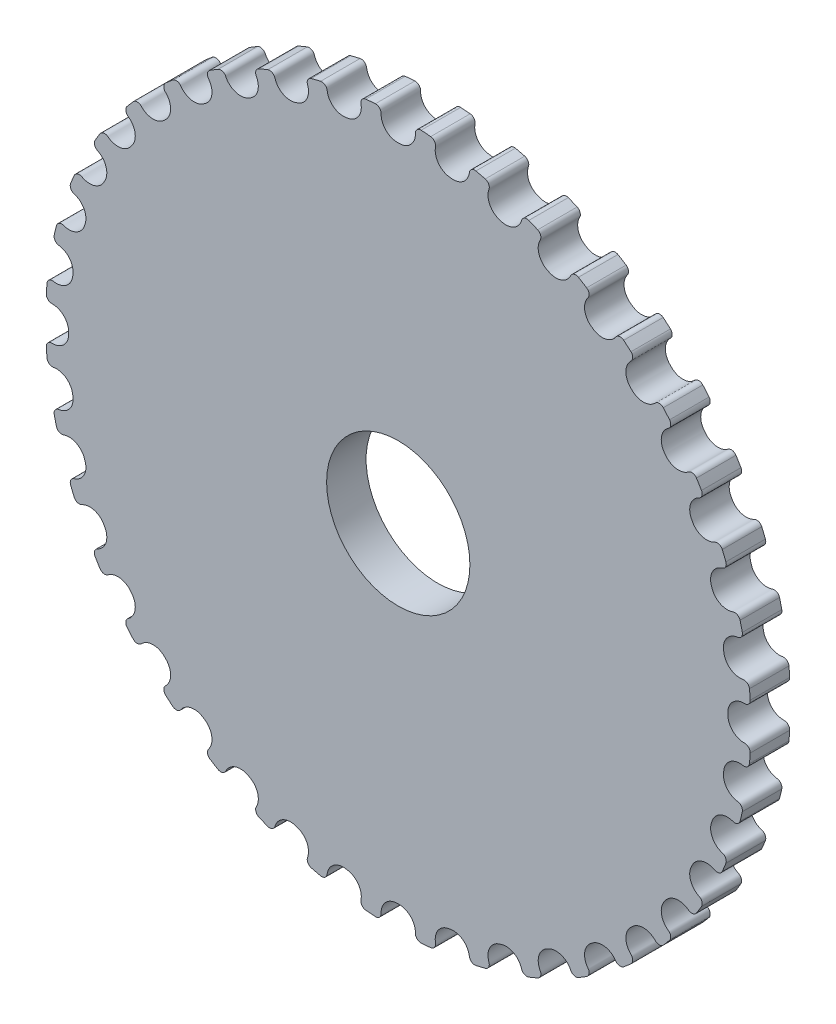
from build123d import *

# Parameters (mm, degrees)
SKETCHREVOLVEGEARBELT01_W       = 3.5
SKETCHREVOLVEGEARBELT01_H       = 31.259474731
TOOTHEXTRUDECUTGEARBELT01_DEPTH = 7.238999891
PATTERNGEARBELT01_COUNT         = 40
BOREREVOLVESKETCH_W             = 14.477999782
BOREREVOLVESKETCH_H             = 6.349999905


with BuildPart() as part:
    # SketchRevolveGearBelt01 → GearBelt01 (revolve)
    with BuildSketch(Plane(origin=(0, 0, 0), x_dir=(0, 0, -1), z_dir=(1, 0, 0))):
        with Locations((0, 15.629737366)):
            Rectangle(SKETCHREVOLVEGEARBELT01_W, SKETCHREVOLVEGEARBELT01_H)
    revolve(axis=Axis((0, 0, 0), (0, 0, -1)))

    # SketchToothGearBelt01 → ToothExtrudeCutGearBelt01 (cut, symmetric)
    with BuildSketch(Plane.XY):
        with BuildLine():
            ThreePointArc((31.193039128, 2.038865882), (31.259601152, 0), (31.193039128, -2.038865882))
            add(Edge.make_bspline(
                [(31.193039128, -2.038865882), (31.194776913, -2.012319058), (31.194111995, -1.972286092), (31.186725044, -1.91954954), (31.177972892, -1.880581805), (31.166066964, -1.842459179), (31.151086916, -1.805436436), (31.133132836, -1.769761004), (31.11232472, -1.735671302), (31.088801629, -1.703395156), (31.062720769, -1.673148271), (31.03425644, -1.645132783), (31.003598871, -1.619535939), (30.970952951, -1.596528744), (30.936536852, -1.576265181), (30.900580587, -1.558879838), (30.863324423, -1.544492019), (30.825017467, -1.533186249), (30.785915276, -1.525081482), (30.746280852, -1.520069931), (30.699160655, -1.5185581), (30.627744929, -1.519642809), (30.531954075, -1.516025397), (30.419766309, -1.502618406), (30.308964203, -1.4805345), (30.200238466, -1.449806972), (30.094256736, -1.410652655), (29.991672503, -1.363305381), (29.893117585, -1.308058815), (29.799199177, -1.245252775), (29.710495857, -1.175274324), (29.627554091, -1.09855453), (29.55088484, -1.015566038), (29.480960449, -0.926820101), (29.418211615, -0.832863447), (29.363025195, -0.73427489), (29.31574008, -0.631661826), (29.276651638, -0.525656278), (29.245985501, -0.416911781), (29.223987221, -0.306096466), (29.210580967, -0.193899714), (29.207480791, -0.105119728), (29.207768884, -0.040500395), (29.2077087, 0), (29.207768884, 0.040500395), (29.207480791, 0.105119728), (29.210580967, 0.193899714), (29.223987221, 0.306096466), (29.245985501, 0.416911781), (29.276651638, 0.525656278), (29.31574008, 0.631661826), (29.363025195, 0.73427489), (29.418211615, 0.832863447), (29.480960449, 0.926820101), (29.55088484, 1.015566038), (29.627554091, 1.09855453), (29.710495857, 1.175274324), (29.799199177, 1.245252775), (29.893117585, 1.308058815), (29.991672503, 1.363305381), (30.094256736, 1.410652655), (30.200238466, 1.449806972), (30.308964203, 1.4805345), (30.419766309, 1.502618406), (30.531954075, 1.516025397), (30.627744929, 1.519642809), (30.699160655, 1.5185581), (30.746280852, 1.520069931), (30.785915276, 1.525081482), (30.825017467, 1.533186249), (30.863324423, 1.544492019), (30.900580587, 1.558879838), (30.936536852, 1.576265181), (30.970952951, 1.596528744), (31.003598871, 1.619535939), (31.03425644, 1.645132783), (31.062720769, 1.673148271), (31.088801629, 1.703395156), (31.11232472, 1.735671302), (31.133132836, 1.769761004), (31.151086916, 1.805436436), (31.166066964, 1.842459179), (31.177972892, 1.880581805), (31.186725044, 1.91954954), (31.194111995, 1.972286092), (31.194776913, 2.012319058), (31.193039128, 2.038865882)],
                knots=[0, 0, 0, 0, 0.012475647, 0.018713471, 0.024951294, 0.031189118, 0.037426941, 0.043664765, 0.049902589, 0.056140412, 0.062378236, 0.068616059, 0.074853883, 0.081091706, 0.08732953, 0.093567353, 0.099805177, 0.106043001, 0.112280824, 0.118518648, 0.124756471, 0.134376181, 0.152024115, 0.169672048, 0.187319982, 0.204967916, 0.22261585, 0.240263783, 0.257911717, 0.275559651, 0.293207585, 0.310855518, 0.328503452, 0.346151386, 0.36379932, 0.381447253, 0.399095187, 0.416743121, 0.434391055, 0.452038988, 0.469686922, 0.487334856, 0.493667428, 0.5, 0.506332572, 0.512665144, 0.530313078, 0.547961012, 0.565608945, 0.583256879, 0.600904813, 0.618552747, 0.63620068, 0.653848614, 0.671496548, 0.689144482, 0.706792415, 0.724440349, 0.742088283, 0.759736217, 0.77738415, 0.795032084, 0.812680018, 0.830327952, 0.847975885, 0.865623819, 0.875243529, 0.881481352, 0.887719176, 0.893956999, 0.900194823, 0.906432647, 0.91267047, 0.918908294, 0.925146117, 0.931383941, 0.937621764, 0.943859588, 0.950097411, 0.956335235, 0.962573059, 0.968810882, 0.975048706, 0.981286529, 0.987524353, 1, 1, 1, 1], degree=3))
        make_face()
    toothextrudecutgearbelt01 = extrude(amount=TOOTHEXTRUDECUTGEARBELT01_DEPTH, both=True, mode=Mode.SUBTRACT)

    # PatternGearBelt01: ToothExtrudeCutGearBelt01 ×40 about axis
    patterngearbelt01_axis = Axis((0, 0, 55), (0, 0, -1))
    for i in range(1, PATTERNGEARBELT01_COUNT):
        add(toothextrudecutgearbelt01.rotate(patterngearbelt01_axis, i * 360 / PATTERNGEARBELT01_COUNT), mode=Mode.SUBTRACT)

    # BoreRevolveSketch → BoreRevolveCut (revolve, cut)
    with BuildSketch(Plane(origin=(0, 0, 0), x_dir=(0, 0, -1), z_dir=(1, 0, 0))):
        with Locations((0, 3.174999953)):
            Rectangle(BOREREVOLVESKETCH_W, BOREREVOLVESKETCH_H)
    revolve(axis=Axis((0, 0, 0), (0, 0, -1)), mode=Mode.SUBTRACT)


solid = part.part
